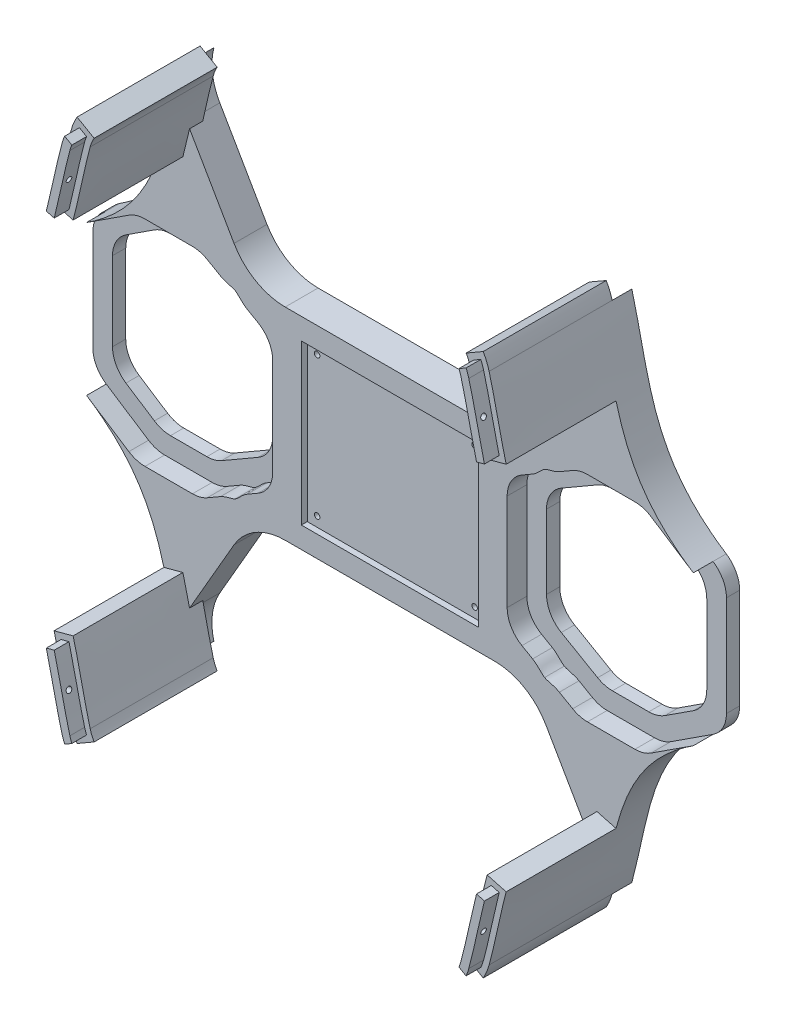
from build123d import *

# Parameters (mm, degrees)
BOSS_EXTRUDE1_START     = -16.230151
BOSS_EXTRUDE1_DEPTH     = 16.720151
BOSS_EXTRUDE2_START     = -6.72015
BOSS_EXTRUDE2_DEPTH     = 62.5
BOSS_EXTRUDE3_DEPTH     = 7.5
CUT_EXTRUDE1_START      = -129.371564681
CUT_EXTRUDE1_OUTLINE_R  = 1.4
CUT_EXTRUDE1_DEPTH      = 4.161075108
MIRROR9_START           = -6.72015
MIRROR9_COPY_1_DEPTH    = 62.5
MIRROR9_COPY_2_DEPTH    = 7.5
MIRROR9_START_2         = -129.371564681
MIRROR9_COPY_3_SKETCH_R = 1.4
MIRROR9_COPY_3_DEPTH    = 4.161075108
BOSS_EXTRUDE8_DEPTH     = 6.720150452
MIRROR10_START          = -29
MIRROR10_DEPTH          = 6.720150452
SKETCH11_R              = 1.4
CUT_EXTRUDE2_DEPTH      = 45
SKETCH11_3_W            = 90
SKETCH11_3_H            = 81
CUT_EXTRUDE3_DEPTH      = 3


# Read off the part's stored shape, not the designer's step: Cut-Extrude1, Mirror10
with BuildPart() as part:
    # Sketch1 → Boss-Extrude1 (new body)
    with BuildSketch(Plane.XY.offset(-12.769849548).offset(BOSS_EXTRUDE1_START)):
        with BuildLine():
            Line((-132.623800424, -51.996986135), (-154.106015422, -38.033381691))
            add(Edge.make_bspline(
                [(-106.150350195, -130.562793241), (-115.728322299, -94.817314715), (-115.408637654, -63.186973918), (-154.106015422, -38.033381691)],
                knots=[0, 0, 0, 0, 1, 1, 1, 1], degree=3))
            ThreePointArc((-106.150350195, -130.562793241), (-106.915921247, -118.882436121), (-103.15333752, -107.798221888))
            Line((-103.15333752, -107.798221888), (-101.790471407, -105.437668536))
            add(Edge.make_bspline(
                [(-101.790471407, -105.437668536), (-102.023097643, -104.401228247), (-103.223478113, -99.093171538), (-105.537980714, -89.515153543), (-109.596851238, -76.722404915), (-114.354915198, -66.170032788), (-118.786271009, -58.785911794), (-121.006240623, -55.584726547), (-121.857207855, -54.420375949)],
                knots=[0.219671274, 0.219671274, 0.219671274, 0.219671274, 0.25, 0.375, 0.5, 0.625, 0.6875, 0.723649719, 0.723649719, 0.723649719, 0.723649719], degree=3))
            Line((-121.857207855, -54.420375949), (-124.448907383, -54.420375949))
            ThreePointArc((-124.448907383, -54.420375949), (-128.712171814, -53.801772835), (-132.623800424, -51.996986135))
        make_face()
        with BuildLine():
            Line((-102.281665351, -56.997634471), (-100.79368445, -54.420375949))
            Line((-100.79368445, -54.420375949), (-121.857207855, -54.420375949))
            add(Edge.make_bspline(
                [(-101.790471407, -105.437668536), (-102.023097643, -104.401228247), (-103.223478113, -99.093171538), (-105.537980714, -89.515153543), (-109.596851238, -76.722404915), (-114.354915198, -66.170032788), (-118.786271009, -58.785911794), (-121.006240623, -55.584726547), (-121.857207855, -54.420375949)],
                knots=[0.219671274, 0.219671274, 0.219671274, 0.219671274, 0.25, 0.375, 0.5, 0.625, 0.6875, 0.723649719, 0.723649719, 0.723649719, 0.723649719], degree=3))
            Line((-101.790471407, -105.437668536), (-95.697255135, -94.883908373))
            ThreePointArc((-95.697255135, -94.883908373), (-105.857849232, -77.134456785), (-102.281665351, -56.997634471))
        make_face()
        with BuildLine():
            Line((59.538929412, -24.533624603), (59.538929412, -11.453593073))
            ThreePointArc((59.538929412, -11.453593073), (55.866159241, -10.366761111), (52.053557671, -10))
            Line((52.053557671, -10), (-52.053557671, -10))
            ThreePointArc((-52.053557671, -10), (-55.866159241, -10.366761111), (-59.538929412, -11.453593073))
            Line((-59.538929412, -11.453593073), (-59.538929412, -24.533624603))
            ThreePointArc((-59.538929412, -24.533624603), (-61.548548355, -32.033624603), (-67.038929412, -37.52400566))
            Line((-67.038929412, -37.52400566), (-72.475365648, -40.662733584))
            add(Edge.make_bspline(
                [(-78.570337194, -45.777518806), (-78.287114365, -45.61400003), (-78.015001802, -45.416707912), (-77.501330798, -44.991243431), (-77.25751933, -44.764584279), (-76.53689786, -44.073044298), (-76.06989364, -43.597561009), (-75.110233941, -42.67450399), (-74.620302397, -42.225655026), (-73.592596646, -41.388008717), (-73.05587467, -40.997890624), (-72.475365648, -40.662733584)],
                knots=[0, 0, 0, 0, 0.125, 0.125, 0.25, 0.25, 0.5, 0.5, 0.75, 0.75, 1, 1, 1, 1], degree=3))
            add(Edge.make_bspline(
                [(-85.724697966, -48.320125741), (-85.240981095, -48.063971889), (-84.742377154, -47.848446528), (-83.614807167, -47.420177598), (-82.981044779, -47.22052379), (-81.702471863, -46.851367791), (-81.056453397, -46.684494831), (-79.779342091, -46.313640652), (-79.147892303, -46.110970404), (-78.570337194, -45.777518806)],
                knots=[0.045741706, 0.045741706, 0.045741706, 0.045741706, 0.25, 0.25, 0.5, 0.5, 0.75, 0.75, 1, 1, 1, 1], degree=3))
            Line((-85.724697966, -48.320125741), (-85.871411314, -48.574240713))
            Line((-85.871411314, -48.574240713), (-93.621411314, -61.997634471))
            ThreePointArc((-93.621411314, -61.997634471), (-96.141645245, -74.516554199), (-90.573060132, -86.008542279))
            Line((-90.573060132, -86.008542279), (-79.196549342, -66.303847577))
            ThreePointArc((-79.196549342, -66.303847577), (-68.215787228, -55.323085464), (-53.215787228, -51.303847577))
            Line((-53.215787228, -51.303847577), (53.215787228, -51.303847577))
            ThreePointArc((53.215787228, -51.303847577), (68.215787228, -55.323085464), (79.196549342, -66.303847577))
            Line((79.196549342, -66.303847577), (90.573060132, -86.008542279))
            ThreePointArc((90.573060132, -86.008542279), (96.141645245, -74.516554199), (93.621411314, -61.997634471))
            Line((93.621411314, -61.997634471), (85.871411314, -48.574240713))
            Line((85.871411314, -48.574240713), (85.724705834, -48.320139368))
            add(Edge.make_bspline(
                [(78.570337194, -45.777518806), (78.853560023, -45.941037583), (79.160476291, -46.078047916), (79.785774842, -46.310167815), (80.103973159, -46.407985164), (81.063175086, -46.686291673), (81.708457803, -46.852987547), (82.98767848, -47.222548715), (83.621358858, -47.422417396), (84.746734896, -47.850306663), (85.243530031, -48.065352225), (85.724705834, -48.320139368)],
                knots=[0, 0, 0, 0, 0.125, 0.125, 0.25, 0.25, 0.5, 0.5, 0.75, 0.75, 0.954045817, 0.954045817, 0.954045817, 0.954045817], degree=3))
            add(Edge.make_bspline(
                [(72.475365648, -40.662733584), (73.058848002, -40.999607278), (73.596723578, -41.391072163), (74.625517965, -42.230209057), (75.115304429, -42.679236481), (76.074289359, -43.601935107), (76.541814815, -44.077967031), (77.501539608, -44.998550775), (77.992782086, -45.444067209), (78.570337194, -45.777518806)],
                knots=[0, 0, 0, 0, 0.25, 0.25, 0.5, 0.5, 0.75, 0.75, 1, 1, 1, 1], degree=3))
            Line((72.475365648, -40.662733584), (67.038929412, -37.52400566))
            ThreePointArc((67.038929412, -37.52400566), (61.548548355, -32.033624603), (59.538929412, -24.533624603))
        make_face()
        with BuildLine():
            add(Edge.make_bspline(
                [(106.150350195, -130.562793241), (115.728322299, -94.817314715), (115.408637654, -63.186973918), (154.106015422, -38.033381691)],
                knots=[0, 0, 0, 0, 1, 1, 1, 1], degree=3))
            Line((154.106015422, -38.033381691), (132.623800424, -51.996986135))
            ThreePointArc((132.623800424, -51.996986135), (128.712171814, -53.801772835), (124.448907383, -54.420375949))
            Line((124.448907383, -54.420375949), (121.857207855, -54.420375949))
            add(Edge.make_bspline(
                [(101.790471407, -105.437668536), (102.023097643, -104.401228247), (103.223478113, -99.093171538), (105.537980714, -89.515153543), (109.596851238, -76.722404915), (114.354915198, -66.170032788), (118.786271009, -58.785911794), (121.006240623, -55.584726547), (121.857207855, -54.420375949)],
                knots=[0.219671274, 0.219671274, 0.219671274, 0.219671274, 0.25, 0.375, 0.5, 0.625, 0.6875, 0.723649719, 0.723649719, 0.723649719, 0.723649719], degree=3))
            Line((101.790471407, -105.437668536), (103.15333752, -107.798221888))
            ThreePointArc((103.15333752, -107.798221888), (106.915921247, -118.882436121), (106.150350195, -130.562793241))
        make_face()
        with BuildLine():
            Line((121.857207855, -54.420375949), (100.79368445, -54.420375949))
            Line((100.79368445, -54.420375949), (102.281665351, -56.997634471))
            ThreePointArc((102.281665351, -56.997634471), (105.857849232, -77.134456785), (95.697255135, -94.883908373))
            Line((95.697255135, -94.883908373), (101.790471407, -105.437668536))
            add(Edge.make_bspline(
                [(101.790471407, -105.437668536), (102.023097643, -104.401228247), (103.223478113, -99.093171538), (105.537980714, -89.515153543), (109.596851238, -76.722404915), (114.354915198, -66.170032788), (118.786271009, -58.785911794), (121.006240623, -55.584726547), (121.857207855, -54.420375949)],
                knots=[0.219671274, 0.219671274, 0.219671274, 0.219671274, 0.25, 0.375, 0.5, 0.625, 0.6875, 0.723649719, 0.723649719, 0.723649719, 0.723649719], degree=3))
        make_face()
        with BuildLine():
            Line((59.538929412, -11.453593073), (59.538929412, -0.948851832))
            ThreePointArc((59.538929412, -0.948851832), (55.82619302, -0.238158281), (52.053557671, 0))
            Line((52.053557671, 0), (-52.053557671, 0))
            ThreePointArc((-52.053557671, 0), (-55.82619302, -0.238158281), (-59.538929412, -0.948851832))
            Line((-59.538929412, -0.948851832), (-59.538929412, -11.453593073))
            ThreePointArc((-59.538929412, -11.453593073), (-55.866159241, -10.366761111), (-52.053557671, -10))
            Line((-52.053557671, -10), (52.053557671, -10))
            ThreePointArc((52.053557671, -10), (55.866159241, -10.366761111), (59.538929412, -11.453593073))
        make_face()
        with BuildLine():
            add(Edge.make_bspline(
                [(101.790471407, 105.437668536), (102.023097643, 104.401228247), (103.223478113, 99.093171538), (105.537980714, 89.515153543), (109.596851238, 76.722404915), (114.354915198, 66.170032788), (118.786271009, 58.785911794), (121.006240623, 55.584726547), (121.857207855, 54.420375949)],
                knots=[0.219671274, 0.219671274, 0.219671274, 0.219671274, 0.25, 0.375, 0.5, 0.625, 0.6875, 0.723649719, 0.723649719, 0.723649719, 0.723649719], degree=3))
            Line((101.790471407, 105.437668536), (79.196549342, 66.303847577))
            ThreePointArc((79.196549342, 66.303847577), (68.215787228, 55.323085464), (53.215787228, 51.303847577))
            Line((53.215787228, 51.303847577), (-53.215787228, 51.303847577))
            ThreePointArc((-53.215787228, 51.303847577), (-68.215787228, 55.323085464), (-79.196549342, 66.303847577))
            Line((-79.196549342, 66.303847577), (-101.790471407, 105.437668536))
            add(Edge.make_bspline(
                [(-101.790471407, 105.437668536), (-102.023097643, 104.401228247), (-103.223478113, 99.093171538), (-105.537980714, 89.515153543), (-109.596851238, 76.722404915), (-114.354915198, 66.170032788), (-118.786271009, 58.785911794), (-121.006240623, 55.584726547), (-121.857207855, 54.420375949)],
                knots=[0.219671274, 0.219671274, 0.219671274, 0.219671274, 0.25, 0.375, 0.5, 0.625, 0.6875, 0.723649719, 0.723649719, 0.723649719, 0.723649719], degree=3))
            Line((-121.857207855, 54.420375949), (-100.323539103, 54.420375949))
            ThreePointArc((-100.323539103, 54.420375949), (-96.441253426, 53.909263344), (-92.823539103, 52.410757006))
            Line((-92.823539103, 52.410757006), (-86.047356905, 48.49852639))
            add(Edge.make_bspline(
                [(-78.570337194, 45.777518806), (-78.853560023, 45.941037583), (-79.160476291, 46.078047916), (-79.785774842, 46.310167815), (-80.103973159, 46.407985164), (-81.063175086, 46.686291673), (-81.708457803, 46.852987547), (-82.98767848, 47.222548715), (-83.621358858, 47.422417396), (-84.860634716, 47.89361353), (-85.466847883, 48.16336935), (-86.047356905, 48.49852639)],
                knots=[0, 0, 0, 0, 0.125, 0.125, 0.25, 0.25, 0.5, 0.5, 0.75, 0.75, 1, 1, 1, 1], degree=3))
            add(Edge.make_bspline(
                [(-72.475365648, 40.662733584), (-73.058848002, 40.999607278), (-73.596723578, 41.391072163), (-74.625517965, 42.230209057), (-75.115304429, 42.679236481), (-76.074289359, 43.601935107), (-76.541814815, 44.077967031), (-77.501539608, 44.998550775), (-77.992782086, 45.444067209), (-78.570337194, 45.777518806)],
                knots=[0, 0, 0, 0, 0.25, 0.25, 0.5, 0.5, 0.75, 0.75, 1, 1, 1, 1], degree=3))
            Line((-72.475365648, 40.662733584), (-67.038929412, 37.52400566))
            ThreePointArc((-67.038929412, 37.52400566), (-61.548548355, 32.033624603), (-59.538929412, 24.533624603))
            Line((-59.538929412, 24.533624603), (-59.538929412, -0.948851832))
            ThreePointArc((-59.538929412, -0.948851832), (-55.82619302, -0.238158281), (-52.053557671, 0))
            Line((-52.053557671, 0), (52.053557671, 0))
            ThreePointArc((52.053557671, 0), (55.82619302, -0.238158281), (59.538929412, -0.948851832))
            Line((59.538929412, -0.948851832), (59.538929412, 24.533624603))
            ThreePointArc((59.538929412, 24.533624603), (61.548548355, 32.033624603), (67.038929412, 37.52400566))
            Line((67.038929412, 37.52400566), (72.475365648, 40.662733584))
            add(Edge.make_bspline(
                [(78.570337194, 45.777518806), (78.287114365, 45.61400003), (78.015001802, 45.416707912), (77.501330798, 44.991243431), (77.25751933, 44.764584279), (76.53689786, 44.073044298), (76.06989364, 43.597561009), (75.110233941, 42.67450399), (74.620302397, 42.225655026), (73.592596646, 41.388008717), (73.05587467, 40.997890624), (72.475365648, 40.662733584)],
                knots=[0, 0, 0, 0, 0.125, 0.125, 0.25, 0.25, 0.5, 0.5, 0.75, 0.75, 1, 1, 1, 1], degree=3))
            add(Edge.make_bspline(
                [(86.047356905, 48.49852639), (85.463874551, 48.161652696), (84.855918228, 47.891571225), (83.614807167, 47.420177598), (82.981044779, 47.22052379), (81.702471863, 46.851367791), (81.056453397, 46.684494831), (79.779342091, 46.313640652), (79.147892303, 46.110970404), (78.570337194, 45.777518806)],
                knots=[0, 0, 0, 0, 0.25, 0.25, 0.5, 0.5, 0.75, 0.75, 1, 1, 1, 1], degree=3))
            Line((86.047356905, 48.49852639), (92.823539103, 52.410757006))
            ThreePointArc((92.823539103, 52.410757006), (96.441253426, 53.909263344), (100.323539103, 54.420375949))
            Line((100.323539103, 54.420375949), (121.857207855, 54.420375949))
        make_face()
        with BuildLine():
            add(Edge.make_bspline(
                [(-101.790471407, 105.437668536), (-102.023097643, 104.401228247), (-103.223478113, 99.093171538), (-105.537980714, 89.515153543), (-109.596851238, 76.722404915), (-114.354915198, 66.170032788), (-118.786271009, 58.785911794), (-121.006240623, 55.584726547), (-121.857207855, 54.420375949)],
                knots=[0.219671274, 0.219671274, 0.219671274, 0.219671274, 0.25, 0.375, 0.5, 0.625, 0.6875, 0.723649719, 0.723649719, 0.723649719, 0.723649719], degree=3))
            Line((-101.790471407, 105.437668536), (-103.15333752, 107.798221888))
            ThreePointArc((-103.15333752, 107.798221888), (-106.915921247, 118.882436121), (-106.150350195, 130.562793241))
            add(Edge.make_bspline(
                [(-106.150350195, 130.562793241), (-115.728322299, 94.817314715), (-115.408637654, 63.186973918), (-154.106015422, 38.033381691)],
                knots=[0, 0, 0, 0, 1, 1, 1, 1], degree=3))
            Line((-154.106015422, 38.033381691), (-132.623800424, 51.996986135))
            ThreePointArc((-132.623800424, 51.996986135), (-128.712171814, 53.801772835), (-124.448907383, 54.420375949))
            Line((-124.448907383, 54.420375949), (-121.857207855, 54.420375949))
        make_face()
        with BuildLine():
            ThreePointArc((106.150350195, 130.562793241), (106.915921247, 118.882436121), (103.15333752, 107.798221888))
            Line((103.15333752, 107.798221888), (101.790471407, 105.437668536))
            add(Edge.make_bspline(
                [(101.790471407, 105.437668536), (102.023097643, 104.401228247), (103.223478113, 99.093171538), (105.537980714, 89.515153543), (109.596851238, 76.722404915), (114.354915198, 66.170032788), (118.786271009, 58.785911794), (121.006240623, 55.584726547), (121.857207855, 54.420375949)],
                knots=[0.219671274, 0.219671274, 0.219671274, 0.219671274, 0.25, 0.375, 0.5, 0.625, 0.6875, 0.723649719, 0.723649719, 0.723649719, 0.723649719], degree=3))
            Line((121.857207855, 54.420375949), (124.448907383, 54.420375949))
            ThreePointArc((124.448907383, 54.420375949), (128.712171814, 53.801772835), (132.623800424, 51.996986135))
            Line((132.623800424, 51.996986135), (154.106015422, 38.033381691))
            add(Edge.make_bspline(
                [(106.150350195, 130.562793241), (115.728322299, 94.817314715), (115.408637654, 63.186973918), (154.106015422, 38.033381691)],
                knots=[0, 0, 0, 0, 1, 1, 1, 1], degree=3))
        make_face()
        with BuildLine():
            Line((-100.323539103, -54.420375949), (-100.79368445, -54.420375949))
            Line((-100.79368445, -54.420375949), (-102.281665351, -56.997634471))
            ThreePointArc((-102.281665351, -56.997634471), (-105.857849232, -77.134456785), (-95.697255135, -94.883908373))
            Line((-95.697255135, -94.883908373), (-90.573060132, -86.008542279))
            ThreePointArc((-90.573060132, -86.008542279), (-96.141645245, -74.516554199), (-93.621411314, -61.997634471))
            Line((-93.621411314, -61.997634471), (-85.871411314, -48.574240713))
            Line((-85.871411314, -48.574240713), (-85.724697966, -48.320125741))
            add(Edge.make_bspline(
                [(-86.047356905, -48.49852639), (-85.940598992, -48.43688968), (-85.833021768, -48.377488964), (-85.724697966, -48.320125741)],
                knots=[0, 0, 0, 0, 0.045741706, 0.045741706, 0.045741706, 0.045741706], degree=3))
            Line((-86.047356905, -48.49852639), (-92.823539103, -52.410757006))
            ThreePointArc((-92.823539103, -52.410757006), (-96.441253426, -53.909263344), (-100.323539103, -54.420375949))
        make_face()
        with BuildLine():
            Line((102.281665351, -56.997634471), (100.79368445, -54.420375949))
            Line((100.79368445, -54.420375949), (100.323539103, -54.420375949))
            ThreePointArc((100.323539103, -54.420375949), (96.441253426, -53.909263344), (92.823539103, -52.410757006))
            Line((92.823539103, -52.410757006), (86.047356905, -48.49852639))
            add(Edge.make_bspline(
                [(85.724705834, -48.320139368), (85.833073854, -48.377521261), (85.940649633, -48.436918918), (86.047356905, -48.49852639)],
                knots=[0.954045817, 0.954045817, 0.954045817, 0.954045817, 1, 1, 1, 1], degree=3))
            Line((85.724705834, -48.320139368), (85.871411314, -48.574240713))
            Line((85.871411314, -48.574240713), (93.621411314, -61.997634471))
            ThreePointArc((93.621411314, -61.997634471), (96.141645245, -74.516554199), (90.573060132, -86.008542279))
            Line((90.573060132, -86.008542279), (95.697255135, -94.883908373))
            ThreePointArc((95.697255135, -94.883908373), (105.857849232, -77.134456785), (102.281665351, -56.997634471))
        make_face()
    extrude(amount=BOSS_EXTRUDE1_DEPTH)

    # Sketch2 → Boss-Extrude2 (add)
    with BuildSketch(Plane.XY.offset(-12.279849548).offset(BOSS_EXTRUDE2_START)):
        with BuildLine():
            ThreePointArc((-106.150350195, -130.562793241), (-104.888961381, -134.278724859), (-103.15333752, -137.798221888))
            Line((-103.15333752, -137.798221888), (-94.493083482, -132.798221888))
            ThreePointArc((-94.493083482, -132.798221888), (-95.650166056, -130.451890535), (-96.491091932, -127.97460279))
            add(Edge.make_bspline(
                [(-96.491091932, -127.97460279), (-97.062543021, -125.84191829), (-98.146677711, -121.549767171), (-100.127474769, -113.008027649), (-102.070893985, -104.039618607), (-103.940262836, -96.141428255), (-104.88329449, -92.515249811), (-105.169913272, -91.448059691)],
                knots=[0, 0, 0, 0, 0.0625, 0.125, 0.25, 0.324913083, 0.356163083, 0.356163083, 0.356163083, 0.356163083], degree=3))
            Line((-105.169913272, -91.448059691), (-114.827663007, -94.041873496))
            add(Edge.make_bspline(
                [(-106.150350195, -130.562793241), (-109.561670272, -117.831573392), (-111.71745139, -105.622367578), (-114.827663007, -94.041873496)],
                knots=[0, 0, 0, 0, 0.356163083, 0.356163083, 0.356163083, 0.356163083], degree=3))
        make_face()
    boss_extrude2 = extrude(amount=BOSS_EXTRUDE2_DEPTH)

    # Sketch3 → Boss-Extrude3 (add)
    with BuildSketch(Plane.XY.offset(43.5)):
        with BuildLine():
            Line((-107.251494658, -95.030595528), (-111.269454365, -96.109712263))
            add(Edge.make_bspline(
                [(-111.269454365, -96.109712263), (-109.846487191, -101.702499571), (-108.620333264, -107.342047155), (-106.109473079, -118.606812629), (-104.823619389, -124.232206364), (-103.329846782, -129.807041629)],
                knots=[0, 0, 0, 0, 0.5, 0.5, 1, 1, 1, 1], degree=3))
            ThreePointArc((-103.329846782, -129.807041629), (-102.714272663, -131.79533816), (-101.947806479, -133.730482645))
            Line((-101.947806479, -133.730482645), (-98.32013493, -131.636045499))
            ThreePointArc((-98.32013493, -131.636045499), (-98.864572792, -130.199819649), (-99.311595345, -128.730354401))
            add(Edge.make_bspline(
                [(-99.311595345, -128.730354401), (-100.80531682, -123.155709965), (-102.088323126, -117.528256021), (-104.597912529, -106.262636556), (-105.82710842, -100.623897208), (-107.251494658, -95.030595528)],
                knots=[0, 0, 0, 0, 0.5, 0.5, 1, 1, 1, 1], degree=3))
        make_face()
    boss_extrude3 = extrude(amount=BOSS_EXTRUDE3_DEPTH)

    # Cut-Extrude1 outline → Cut-Extrude1 (cut)
    with BuildSketch(Plane(origin=(0, 0, 0), x_dir=(-0.217556198163199, 0.9760477962890829, 0), z_dir=(0.9760477962890829, 0.21755619816319896, 0)).offset(CUT_EXTRUDE1_START)):
        with Locations((-87.100742443, 47.5)):
            Circle(CUT_EXTRUDE1_OUTLINE_R)
    cut_extrude1 = extrude(amount=CUT_EXTRUDE1_DEPTH, mode=Mode.SUBTRACT)

    # Mirror8: Boss-Extrude2, Boss-Extrude3, Cut-Extrude1 across plane
    add(boss_extrude2.mirror(Plane.ZX))
    add(boss_extrude3.mirror(Plane.ZX))
    add(cut_extrude1.mirror(Plane.ZX), mode=Mode.SUBTRACT)

    # Mirror9: Boss-Extrude2, Boss-Extrude3, Cut-Extrude1 across plane
    add(boss_extrude2.mirror(Plane(origin=(0, 0, 0), x_dir=(0, 0, 1), z_dir=(1, 0, 0))))
    add(boss_extrude3.mirror(Plane(origin=(0, 0, 0), x_dir=(0, 0, 1), z_dir=(1, 0, 0))))
    add(cut_extrude1.mirror(Plane(origin=(0, 0, 0), x_dir=(0, 0, 1), z_dir=(1, 0, 0))), mode=Mode.SUBTRACT)

    # Mirror9 copy 1 sketch → Mirror9 copy 1 (add)
    with BuildSketch(Plane(origin=(0, 0, -12.279849548), x_dir=(-1, 0, 0), z_dir=(0, 0, 1)).offset(MIRROR9_START)):
        with BuildLine():
            ThreePointArc((-106.150350195, -130.562793241), (-104.888961381, -134.278724859), (-103.15333752, -137.798221888))
            Line((-103.15333752, -137.798221888), (-94.493083482, -132.798221888))
            ThreePointArc((-94.493083482, -132.798221888), (-95.650166056, -130.451890535), (-96.491091932, -127.97460279))
            add(Edge.make_bspline(
                [(-96.491091932, -127.97460279), (-97.062543021, -125.84191829), (-98.146677711, -121.549767171), (-100.127474769, -113.008027649), (-102.070893985, -104.039618607), (-103.940262836, -96.141428255), (-104.88329449, -92.515249811), (-105.169913272, -91.448059691)],
                knots=[0, 0, 0, 0, 0.0625, 0.125, 0.25, 0.324913083, 0.356163083, 0.356163083, 0.356163083, 0.356163083], degree=3))
            Line((-105.169913272, -91.448059691), (-114.827663007, -94.041873496))
            add(Edge.make_bspline(
                [(-106.150350195, -130.562793241), (-109.561670272, -117.831573392), (-111.71745139, -105.622367578), (-114.827663007, -94.041873496)],
                knots=[0, 0, 0, 0, 0.356163083, 0.356163083, 0.356163083, 0.356163083], degree=3))
        make_face()
    extrude(amount=MIRROR9_COPY_1_DEPTH)

    # Mirror9 copy 2 sketch → Mirror9 copy 2 (add)
    with BuildSketch(Plane(origin=(0, 0, 43.5), x_dir=(-1, 0, 0), z_dir=(0, 0, 1))):
        with BuildLine():
            Line((-107.251494658, -95.030595528), (-111.269454365, -96.109712263))
            add(Edge.make_bspline(
                [(-111.269454365, -96.109712263), (-109.846487191, -101.702499571), (-108.620333264, -107.342047155), (-106.109473079, -118.606812629), (-104.823619389, -124.232206364), (-103.329846782, -129.807041629)],
                knots=[0, 0, 0, 0, 0.5, 0.5, 1, 1, 1, 1], degree=3))
            ThreePointArc((-103.329846782, -129.807041629), (-102.714272663, -131.79533816), (-101.947806479, -133.730482645))
            Line((-101.947806479, -133.730482645), (-98.32013493, -131.636045499))
            ThreePointArc((-98.32013493, -131.636045499), (-98.864572792, -130.199819649), (-99.311595345, -128.730354401))
            add(Edge.make_bspline(
                [(-99.311595345, -128.730354401), (-100.80531682, -123.155709965), (-102.088323126, -117.528256021), (-104.597912529, -106.262636556), (-105.82710842, -100.623897208), (-107.251494658, -95.030595528)],
                knots=[0, 0, 0, 0, 0.5, 0.5, 1, 1, 1, 1], degree=3))
        make_face()
    extrude(amount=MIRROR9_COPY_2_DEPTH)

    # Mirror9 copy 3 sketch → Mirror9 copy 3 (cut)
    with BuildSketch(Plane(origin=(0, 0, 0), x_dir=(0.217556198163199, -0.9760477962890829, 0), z_dir=(-0.9760477962890829, -0.21755619816319896, 0)).offset(MIRROR9_START_2)):
        with Locations((-87.100742443, 47.5)):
            Circle(MIRROR9_COPY_3_SKETCH_R)
    extrude(amount=MIRROR9_COPY_3_DEPTH, mode=Mode.SUBTRACT)

    # Sketch9 → Boss-Extrude8 (add)
    with BuildSketch(Plane(origin=(0, 0, -29), x_dir=(-1, 0, 0), z_dir=(0, 0, -1))):
        with BuildLine():
            Line((-160.931122381, 8.956765075), (-160.931122381, 25.456771505))
            ThreePointArc((-160.931122381, 25.456771505), (-159.114888831, 32.611371577), (-154.106015422, 38.033381691))
            Line((-154.106015422, 38.033381691), (-132.623800424, 51.996986135))
            ThreePointArc((-132.623800424, 51.996986135), (-128.712171814, 53.801772835), (-124.448907383, 54.420375949))
            Line((-124.448907383, 54.420375949), (-100.323539103, 54.420375949))
            ThreePointArc((-100.323539103, 54.420375949), (-96.441253426, 53.909263344), (-92.823539103, 52.410757006))
            Line((-92.823539103, 52.410757006), (-86.047356905, 48.49852639))
            add(Edge.make_bspline(
                [(-78.570337194, 45.777518806), (-79.147892303, 46.110970404), (-79.779342091, 46.313640652), (-81.056453397, 46.684494831), (-81.702471863, 46.851367791), (-82.981044779, 47.22052379), (-83.614807167, 47.420177598), (-84.855918228, 47.891571225), (-85.463874551, 48.161652696), (-86.047356905, 48.49852639)],
                knots=[0, 0, 0, 0, 0.25, 0.25, 0.5, 0.5, 0.75, 0.75, 1, 1, 1, 1], degree=3))
            add(Edge.make_bspline(
                [(-72.475365648, 40.662733584), (-73.05587467, 40.997890624), (-73.592596646, 41.388008717), (-74.620302397, 42.225655026), (-75.110233941, 42.67450399), (-76.06989364, 43.597561009), (-76.53689786, 44.073044298), (-77.25751933, 44.764584279), (-77.501330798, 44.991243431), (-78.015001802, 45.416707912), (-78.287114365, 45.61400003), (-78.570337194, 45.777518806)],
                knots=[0, 0, 0, 0, 0.25, 0.25, 0.5, 0.5, 0.75, 0.75, 0.875, 0.875, 1, 1, 1, 1], degree=3))
            Line((-72.475365648, 40.662733584), (-67.038929412, 37.52400566))
            ThreePointArc((-67.038929412, 37.52400566), (-61.548548355, 32.033624603), (-59.538929412, 24.533624603))
            Line((-59.538929412, 24.533624603), (-59.538929412, -24.533624603))
            ThreePointArc((-59.538929412, -24.533624603), (-61.548548355, -32.033624603), (-67.038929412, -37.52400566))
            Line((-67.038929412, -37.52400566), (-72.475365648, -40.662733584))
            add(Edge.make_bspline(
                [(-78.570337194, -45.777518806), (-77.992782086, -45.444067209), (-77.501539608, -44.998550775), (-76.541814815, -44.077967031), (-76.074289359, -43.601935107), (-75.115304429, -42.679236481), (-74.625517965, -42.230209057), (-73.596723578, -41.391072163), (-73.058848002, -40.999607278), (-72.475365648, -40.662733584)],
                knots=[0, 0, 0, 0, 0.25, 0.25, 0.5, 0.5, 0.75, 0.75, 1, 1, 1, 1], degree=3))
            add(Edge.make_bspline(
                [(-86.047356905, -48.49852639), (-85.466847883, -48.16336935), (-84.860634716, -47.89361353), (-83.621358858, -47.422417396), (-82.98767848, -47.222548715), (-81.708457803, -46.852987547), (-81.063175086, -46.686291673), (-80.103973159, -46.407985164), (-79.785774842, -46.310167815), (-79.160476291, -46.078047916), (-78.853560023, -45.941037583), (-78.570337194, -45.777518806)],
                knots=[0, 0, 0, 0, 0.25, 0.25, 0.5, 0.5, 0.75, 0.75, 0.875, 0.875, 1, 1, 1, 1], degree=3))
            Line((-86.047356905, -48.49852639), (-92.823539103, -52.410757006))
            ThreePointArc((-92.823539103, -52.410757006), (-96.441253426, -53.909263344), (-100.323539103, -54.420375949))
            Line((-100.323539103, -54.420375949), (-124.448907383, -54.420375949))
            ThreePointArc((-124.448907383, -54.420375949), (-128.712171814, -53.801772835), (-132.623800424, -51.996986135))
            Line((-132.623800424, -51.996986135), (-154.106015422, -38.033381691))
            ThreePointArc((-154.106015422, -38.033381691), (-159.114888831, -32.611371577), (-160.931122381, -25.456771505))
            Line((-160.931122381, -25.456771505), (-160.931122381, -8.956765075))
            Line((-160.931122381, -8.956765075), (-160.931122381, 8.956765075))
        make_face()
        with BuildLine():
            Line((-121.484477388, 44.420375949), (-103.003031027, 44.420375949))
            ThreePointArc((-103.003031027, 44.420375949), (-99.120745351, 43.909263344), (-95.503031027, 42.410757006))
            Line((-95.503031027, 42.410757006), (-77.038929412, 31.750502968))
            ThreePointArc((-77.038929412, 31.750502968), (-71.548548355, 26.260121911), (-69.538929412, 18.760121911))
            Line((-69.538929412, 18.760121911), (-69.538929412, -18.760121911))
            ThreePointArc((-69.538929412, -18.760121911), (-71.548548355, -26.260121911), (-77.038929412, -31.750502968))
            Line((-77.038929412, -31.750502968), (-95.503031027, -42.410757006))
            ThreePointArc((-95.503031027, -42.410757006), (-99.120745351, -43.909263344), (-103.003031027, -44.420375949))
            Line((-103.003031027, -44.420375949), (-121.484477388, -44.420375949))
            ThreePointArc((-121.484477388, -44.420375949), (-125.747741819, -43.801772835), (-129.659370429, -41.996986135))
            Line((-129.659370429, -41.996986135), (-144.106015422, -32.606556133))
            ThreePointArc((-144.106015422, -32.606556133), (-149.114888831, -27.184546019), (-150.931122381, -20.029945947))
            Line((-150.931122381, -20.029945947), (-150.931122381, 20.029945947))
            ThreePointArc((-150.931122381, 20.029945947), (-149.114888831, 27.184546019), (-144.106015422, 32.606556133))
            Line((-144.106015422, 32.606556133), (-129.659370429, 41.996986135))
            ThreePointArc((-129.659370429, 41.996986135), (-125.747741819, 43.801772835), (-121.484477388, 44.420375949))
        make_face(mode=Mode.SUBTRACT)
    extrude(amount=-BOSS_EXTRUDE8_DEPTH)

    # Mirror10 outline → Mirror10 (add)
    with BuildSketch(Plane.XY.offset(MIRROR10_START)):
        with BuildLine():
            Line((-160.931122381, 25.456771505), (-160.931122381, -25.456771505))
            ThreePointArc((-160.931122381, -25.456771505), (-159.114888831, -32.611371577), (-154.106015422, -38.033381691))
            Line((-154.106015422, -38.033381691), (-132.623800424, -51.996986135))
            ThreePointArc((-132.623800424, -51.996986135), (-128.712171814, -53.801772835), (-124.448907383, -54.420375949))
            Line((-124.448907383, -54.420375949), (-100.323539103, -54.420375949))
            ThreePointArc((-100.323539103, -54.420375949), (-96.441253426, -53.909263344), (-92.823539103, -52.410757006))
            Line((-92.823539103, -52.410757006), (-86.047356905, -48.49852639))
            add(Edge.make_bspline(
                [(-86.047356905, -48.49852639), (-85.463874551, -48.161652696), (-84.855918228, -47.891571225), (-83.614807167, -47.420177598), (-82.981044779, -47.22052379), (-81.702471863, -46.851367791), (-81.056453397, -46.684494831), (-79.779342091, -46.313640652), (-79.147892303, -46.110970404), (-78.287114365, -45.61400003), (-78.015001802, -45.416707912), (-77.501330798, -44.991243431), (-77.25751933, -44.764584279), (-76.53689786, -44.073044298), (-76.06989364, -43.597561009), (-75.110233941, -42.67450399), (-74.620302397, -42.225655026), (-73.592596646, -41.388008717), (-73.05587467, -40.997890624), (-72.475365648, -40.662733584)],
                knots=[0, 0, 0, 0, 0.25, 0.25, 0.5, 0.5, 0.75, 0.75, 1, 1, 1.122595587, 1.122595587, 1.245191173, 1.245191173, 1.490382346, 1.490382346, 1.735573519, 1.735573519, 1.980764692, 1.980764692, 1.980764692, 1.980764692], degree=3))
            Line((-72.475365648, -40.662733584), (-67.038929412, -37.52400566))
            ThreePointArc((-67.038929412, -37.52400566), (-61.548548355, -32.033624603), (-59.538929412, -24.533624603))
            Line((-59.538929412, -24.533624603), (-59.538929412, 24.533624603))
            ThreePointArc((-59.538929412, 24.533624603), (-61.548548355, 32.033624603), (-67.038929412, 37.52400566))
            Line((-67.038929412, 37.52400566), (-72.475365648, 40.662733584))
            add(Edge.make_bspline(
                [(-72.475365648, 40.662733584), (-73.058848002, 40.999607278), (-73.596723578, 41.391072163), (-74.625517965, 42.230209057), (-75.115304429, 42.679236481), (-76.074289359, 43.601935107), (-76.541814815, 44.077967031), (-77.501539608, 44.998550775), (-77.992782086, 45.444067209), (-78.853560023, 45.941037583), (-79.160476291, 46.078047916), (-79.785774842, 46.310167815), (-80.103973159, 46.407985164), (-81.063175086, 46.686291673), (-81.708457803, 46.852987547), (-82.98767848, 47.222548715), (-83.621358858, 47.422417396), (-84.860634716, 47.89361353), (-85.466847883, 48.16336935), (-86.047356905, 48.49852639)],
                knots=[0, 0, 0, 0, 0.25, 0.25, 0.5, 0.5, 0.75, 0.75, 1, 1, 1.122595587, 1.122595587, 1.245191173, 1.245191173, 1.490382346, 1.490382346, 1.735573519, 1.735573519, 1.980764692, 1.980764692, 1.980764692, 1.980764692], degree=3))
            Line((-86.047356905, 48.49852639), (-92.823539103, 52.410757006))
            ThreePointArc((-92.823539103, 52.410757006), (-96.441253426, 53.909263344), (-100.323539103, 54.420375949))
            Line((-100.323539103, 54.420375949), (-124.448907383, 54.420375949))
            ThreePointArc((-124.448907383, 54.420375949), (-128.712171814, 53.801772835), (-132.623800424, 51.996986135))
            Line((-132.623800424, 51.996986135), (-154.106015422, 38.033381691))
            ThreePointArc((-154.106015422, 38.033381691), (-159.114888831, 32.611371577), (-160.931122381, 25.456771505))
        make_face()
        with BuildLine():
            ThreePointArc((-95.503031027, -42.410757006), (-99.12074535, -43.909263344), (-103.003031027, -44.420375949))
            Line((-103.003031027, -44.420375949), (-121.484477388, -44.420375949))
            ThreePointArc((-121.484477388, -44.420375949), (-125.747741819, -43.801772835), (-129.659370429, -41.996986135))
            Line((-129.659370429, -41.996986135), (-144.106015422, -32.606556133))
            ThreePointArc((-144.106015422, -32.606556133), (-149.114888831, -27.184546019), (-150.931122381, -20.029945947))
            Line((-150.931122381, -20.029945947), (-150.931122381, 20.029945947))
            ThreePointArc((-150.931122381, 20.029945947), (-149.114888831, 27.184546019), (-144.106015422, 32.606556133))
            Line((-144.106015422, 32.606556133), (-129.659370429, 41.996986135))
            ThreePointArc((-129.659370429, 41.996986135), (-125.747741819, 43.801772835), (-121.484477388, 44.420375949))
            Line((-121.484477388, 44.420375949), (-103.003031027, 44.420375949))
            ThreePointArc((-103.003031027, 44.420375949), (-99.12074535, 43.909263344), (-95.503031027, 42.410757006))
            Line((-95.503031027, 42.410757006), (-77.038929412, 31.750502968))
            ThreePointArc((-77.038929412, 31.750502968), (-71.548548355, 26.260121911), (-69.538929412, 18.760121911))
            Line((-69.538929412, 18.760121911), (-69.538929412, -18.760121911))
            ThreePointArc((-69.538929412, -18.760121911), (-71.548548355, -26.260121911), (-77.038929412, -31.750502968))
            Line((-77.038929412, -31.750502968), (-95.503031027, -42.410757006))
        make_face(mode=Mode.SUBTRACT)
    extrude(amount=MIRROR10_DEPTH)

    # Sketch11 → Cut-Extrude2 (cut)
    with BuildSketch(Plane.XY.offset(-12.279849548)):
        with Locations((-40, -35.5)):
            Circle(SKETCH11_R)
        with Locations((-40, 35.5)):
            Circle(SKETCH11_R)
        with Locations((40, 35.5)):
            Circle(SKETCH11_R)
        with Locations((40, -35.5)):
            Circle(SKETCH11_R)
    extrude(amount=-CUT_EXTRUDE2_DEPTH, mode=Mode.SUBTRACT)

    # Sketch11<3> → Cut-Extrude3 (cut)
    with BuildSketch(Plane.XY.offset(-12.279849548)):
        Rectangle(SKETCH11_3_W, SKETCH11_3_H)
    extrude(amount=-CUT_EXTRUDE3_DEPTH, mode=Mode.SUBTRACT)


solid = part.part
